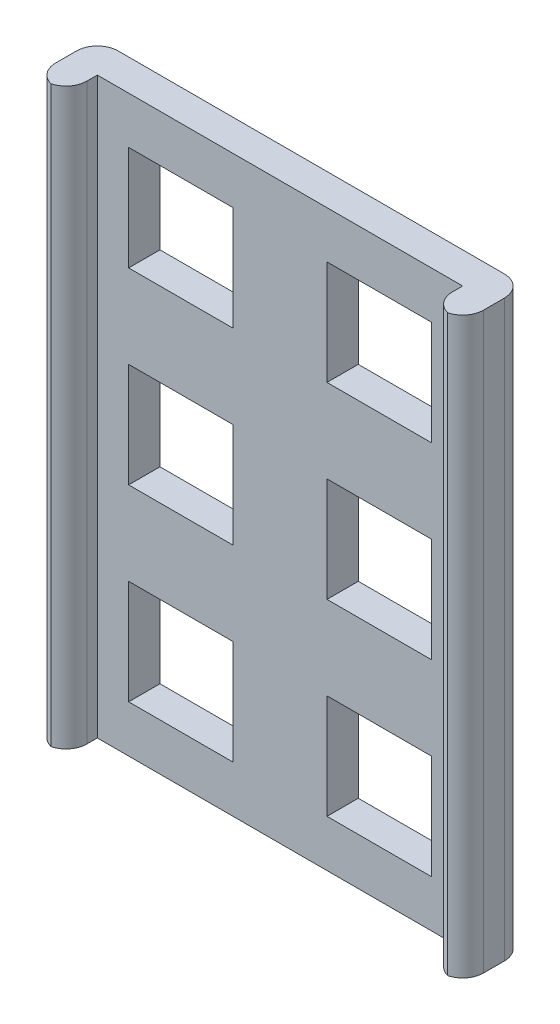
from build123d import *

# Parameters (mm, degrees)
CROQUIS1_W              = 41
CROQUIS1_H              = 55
SALIENTE_EXTRUIR1_DEPTH = 6
CROQUIS2_W              = 35
CROQUIS2_H              = 55
CORTAR_EXTRUIR1_DEPTH   = 3
REDONDEO1_R             = 2
CROQUIS3_W              = 10
CROQUIS3_H              = 10
CORTAR_EXTRUIR2_DEPTH   = 3


with BuildPart() as part:
    # Croquis1 → Saliente-Extruir1 (new body)
    with BuildSketch(Plane.XY):
        with Locations((-72.407619756, 7.664233577)):
            Rectangle(CROQUIS1_W, CROQUIS1_H)
    extrude(amount=SALIENTE_EXTRUIR1_DEPTH)

    # Croquis2 → Cortar-Extruir1 (cut)
    with BuildSketch(Plane.XY.offset(6)):
        with Locations((-72.407619756, 7.664233577)):
            Rectangle(CROQUIS2_W, CROQUIS2_H)
    extrude(amount=-CORTAR_EXTRUIR1_DEPTH, mode=Mode.SUBTRACT)

    # Redondeo1
    # the kernel refuses this fillet: 2 mm, written as the material it takes off along each edge
    with BuildSketch(Plane(origin=(-54.907619756, 40.164233577, 6), x_dir=(1, 0, 0), z_dir=(0, -1, 0)), Plane(origin=(-51.907619756, 40.164233577, 6), x_dir=(0, 0, -1), z_dir=(0, -1, 0)), Plane(origin=(-51.907619756, 40.164233577, 0), x_dir=(-1, 0, 0), z_dir=(0, -1, 0)), Plane(origin=(-92.907619756, -24.835766423, 0), x_dir=(1, 0, 0), z_dir=(0, 1, 0))) as redondeo1_piece_1:
        with BuildLine():
            CenterArc((REDONDEO1_R, -REDONDEO1_R), REDONDEO1_R, 90, 90)
            Line((0, -REDONDEO1_R), (0, 0))
            Line((0, 0), (REDONDEO1_R, 0))
        make_face()
    extrude(amount=65, mode=Mode.SUBTRACT)
    with BuildSketch(Plane(origin=(-92.907619756, -24.835766423, 6), x_dir=(1, 0, 0), z_dir=(0, 1, 0)), Plane(origin=(-89.907619756, -24.835766423, 6), x_dir=(0, 0, -1), z_dir=(0, 1, 0))) as redondeo1_piece_2:
        with BuildLine():
            CenterArc((REDONDEO1_R, REDONDEO1_R), REDONDEO1_R, 180, 90)
            Line((0, REDONDEO1_R), (0, 0))
            Line((0, 0), (REDONDEO1_R, 0))
        make_face()
    extrude(amount=65, mode=Mode.SUBTRACT)

    # Croquis3 → Cortar-Extruir2 (cut)
    with BuildSketch(Plane(origin=(0, 0, 0), x_dir=(-1, 0, 0), z_dir=(0, 0, -1))):
        with Locations((81.907619756, -10.335766423)):
            Rectangle(CROQUIS3_W, CROQUIS3_H)
        with Locations((62.907619756, -10.335766423)):
            Rectangle(CROQUIS3_W, CROQUIS3_H)
        with Locations((62.907619756, 7.664233577)):
            Rectangle(CROQUIS3_W, CROQUIS3_H)
        with Locations((62.907619756, 25.664233577)):
            Rectangle(CROQUIS3_W, CROQUIS3_H)
        with Locations((81.907619756, 7.664233577)):
            Rectangle(CROQUIS3_W, CROQUIS3_H)
        with Locations((81.907619756, 25.664233577)):
            Rectangle(CROQUIS3_W, CROQUIS3_H)
    extrude(amount=-CORTAR_EXTRUIR2_DEPTH, mode=Mode.SUBTRACT)


solid = part.part
